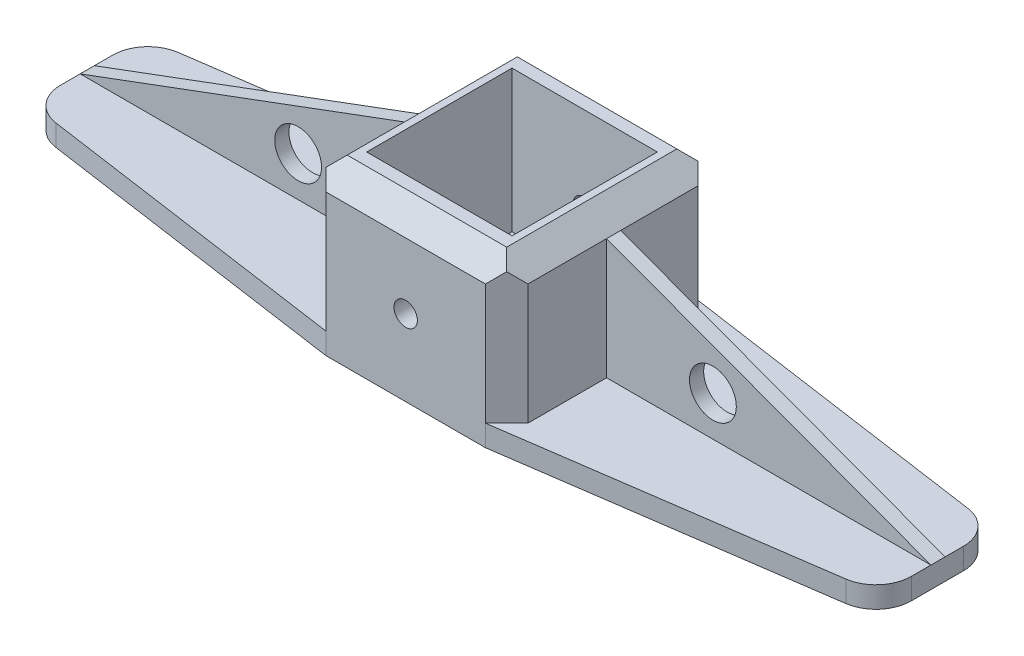
from build123d import *

# Parameters (mm, degrees)
SKETCH1_W           = 120
SKETCH1_H           = 30
BOSS_EXTRUDE1_DEPTH = 3
SKETCH2_W           = 28.5
SKETCH2_H           = 30
SKETCH2_W_2         = 20.5
SKETCH2_H_2         = 20.5
BOSS_EXTRUDE2_DEPTH = 20
CHAMFER1_SIZE       = 3
CHAMFER2_SIZE       = 3
CUT_EXTRUDE1_DEPTH  = 20
SKETCH4_R           = 1.65
CUT_EXTRUDE2_DEPTH  = 40
CUT_EXTRUDE3_DEPTH  = 40
SKETCH6_W           = 45.75
SKETCH6_H           = 2
BOSS_EXTRUDE3_DEPTH = 17
CUT_EXTRUDE5_DEPTH  = 17
SKETCH8_R           = 3.302
CUT_EXTRUDE6_DEPTH  = 17
FILLET1_R           = 5


with BuildPart() as part:
    # Sketch1 → Boss-Extrude1 (new body)
    with BuildSketch(Plane(origin=(0, 0, 0), x_dir=(1, 0, 0), z_dir=(0, 1, 0))):
        Rectangle(SKETCH1_W, SKETCH1_H)
    extrude(amount=BOSS_EXTRUDE1_DEPTH)

    # Sketch2 → Boss-Extrude2 (add)
    with BuildSketch(Plane(origin=(0, 3, 0), x_dir=(1, 0, 0), z_dir=(0, 1, 0))):
        Rectangle(SKETCH2_W, SKETCH2_H)
        Rectangle(SKETCH2_W_2, SKETCH2_H_2, mode=Mode.SUBTRACT)
    extrude(amount=BOSS_EXTRUDE2_DEPTH)

    # Chamfer1
    chamfer1_edges = [part.edges().sort_by_distance(p)[0] for p in [
        (14.25, 13, 15),
        (14.25, 13, -15),
        (-14.25, 13, -15),
        (-14.25, 13, 15),
    ]]
    chamfer(chamfer1_edges, length=CHAMFER1_SIZE)

    # Chamfer2
    # the kernel refuses this chamfer: 3 mm, written as the material it takes off along each edge
    with BuildSketch(Plane(origin=(18.965048964, 23, -15), x_dir=(0, -0.9996219169112968, -0.02749587661058619), z_dir=(-1, 0, 0)), Plane(origin=(-18.965048964, 23, 15), x_dir=(0, -0.9996219169112968, 0.02749587661058619), z_dir=(1, 0, 0))) as chamfer2_piece_1:
        Polygon((CHAMFER2_SIZE * 0.999621916911, CHAMFER2_SIZE * 0.0274958766106), (-CHAMFER2_SIZE * 0.0274958766106, CHAMFER2_SIZE * 0.999621916911), (0, 0), align=None)
    extrude(amount=37.930097928, mode=Mode.SUBTRACT)
    with BuildSketch(Plane(origin=(14.25, 23, 19.715048964), x_dir=(0.02749587661058619, -0.9996219169112968, 0), z_dir=(0, 0, -1)), Plane(origin=(-14.25, 23, -19.715048964), x_dir=(-0.02749587661058619, -0.9996219169112968, 0), z_dir=(0, 0, 1))) as chamfer2_piece_2:
        Polygon((CHAMFER2_SIZE * 0.999621916911, CHAMFER2_SIZE * 0.0274958766106), (-CHAMFER2_SIZE * 0.0274958766106, CHAMFER2_SIZE * 0.999621916911), (0, 0), align=None)
    extrude(amount=39.430097928, mode=Mode.SUBTRACT)

    # Sketch3 → Cut-Extrude1 (cut)
    with BuildSketch(Plane(origin=(0, 3, 0), x_dir=(1, 0, 0), z_dir=(0, 1, 0))):
        Polygon((-11.25, 15), (-60, 8), (-60, 15), align=None)
        Polygon((-11.25, -15), (-60, -8), (-60, -15), align=None)
        Polygon((11.25, 15), (60, 15), (60, 8), align=None)
        Polygon((11.25, -15), (60, -15), (60, -8), align=None)
    extrude(amount=-CUT_EXTRUDE1_DEPTH, mode=Mode.SUBTRACT)

    # Sketch4 → Cut-Extrude2 (cut)
    with BuildSketch(Plane.XY.offset(15)):
        with Locations((0, 10.735706987)):
            Circle(SKETCH4_R)
    extrude(amount=-CUT_EXTRUDE2_DEPTH, mode=Mode.SUBTRACT)

    # Sketch5 → Cut-Extrude3 (cut)
    with BuildSketch(Plane(origin=(0, 3, 0), x_dir=(1, 0, 0), z_dir=(0, 1, 0))):
        with BuildLine():
            Line((-9, -1), (-5.916079783, -1))
            ThreePointArc((-5.916079783, -1), (-4.242640687, -4.242640687), (-1, -5.916079783))
            Line((-1, -5.916079783), (-1, -9))
            Line((-1, -9), (1, -9))
            Line((1, -9), (1, -5.916079783))
            ThreePointArc((1, -5.916079783), (4.242640687, -4.242640687), (5.916079783, -1))
            Line((5.916079783, -1), (9, -1))
            Line((9, -1), (9, 1))
            Line((9, 1), (5.916079783, 1))
            ThreePointArc((5.916079783, 1), (4.242640687, 4.242640687), (1, 5.916079783))
            Line((1, 5.916079783), (1, 9))
            Line((1, 9), (-1, 9))
            Line((-1, 9), (-1, 5.916079783))
            ThreePointArc((-1, 5.916079783), (-4.242640687, 4.242640687), (-5.916079783, 1))
            Line((-5.916079783, 1), (-9, 1))
            Line((-9, 1), (-9, -1))
        make_face()
    extrude(amount=-CUT_EXTRUDE3_DEPTH, mode=Mode.SUBTRACT)

    # Sketch6 → Boss-Extrude3 (add)
    with BuildSketch(Plane(origin=(0, 3, 0), x_dir=(1, 0, 0), z_dir=(0, 1, 0))):
        with Locations((-37.125, 0.087113991)):
            Rectangle(SKETCH6_W, SKETCH6_H)
        with Locations((37.125, 0.087113991)):
            Rectangle(SKETCH6_W, SKETCH6_H)
    extrude(amount=BOSS_EXTRUDE3_DEPTH)

    # Sketch7 → Cut-Extrude5 (cut)
    with BuildSketch(Plane.XY.offset(0.912886009)):
        Polygon((-14.25, 20), (-60, 3), (-66.007429388, 26.966086251), align=None)
        Polygon((14.25, 20), (60, 3), (71.057586423, 29.350453949), align=None)
    extrude(amount=-CUT_EXTRUDE5_DEPTH, mode=Mode.SUBTRACT)

    # Sketch8 → Cut-Extrude6 (cut)
    with BuildSketch(Plane.XY.offset(0.912886009)):
        with Locations((-29.25, 8.622465364)):
            Circle(SKETCH8_R)
        with Locations((29.25, 8.622465364)):
            Circle(SKETCH8_R)
    extrude(amount=-CUT_EXTRUDE6_DEPTH, mode=Mode.SUBTRACT)

    # Fillet1
    fillet1_edges = [part.edges().sort_by_distance(p)[0] for p in [
        (-60, 1.5, -8),
        (-60, 1.5, 8),
        (60, 1.5, -8),
        (60, 1.5, 8),
    ]]
    fillet(fillet1_edges, radius=FILLET1_R)


solid = part.part
